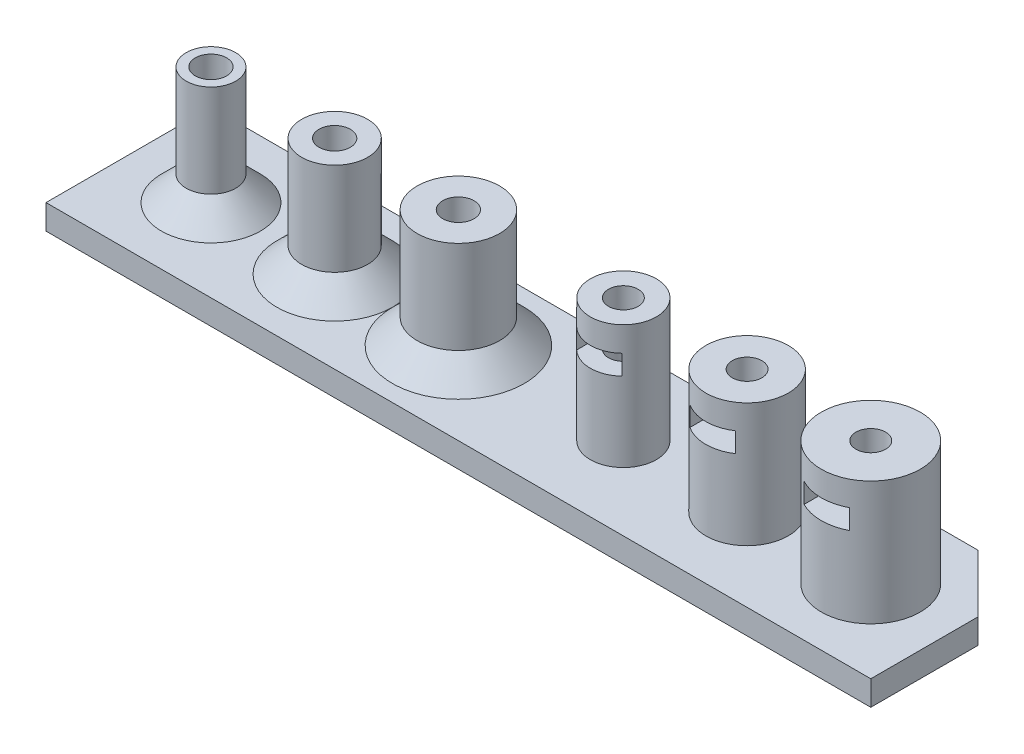
from build123d import *

# Parameters (mm, degrees)
SKETCH1_W           = 100
SKETCH1_H           = 20
BOSS_EXTRUDE1_DEPTH = 3
SKETCH2_R           = 4
SKETCH2_R_2         = 1.9
SKETCH2_R_3         = 3
SKETCH2_R_4         = 5
BOSS_EXTRUDE2_DEPTH = 14.25
CHAMFER1_SIZE       = 3
CHAMFER2_SIZE       = 3
CHAMFER3_SIZE       = 3
SKETCH14_R          = 4
SKETCH14_R_2        = 1.8
SKETCH14_R_3        = 5
SKETCH14_R_4        = 6
BOSS_EXTRUDE3_DEPTH = 15
CHAMFER4_SIZE       = 7
CUT_EXTRUDE2_START  = 12
CUT_EXTRUDE2_DEPTH  = 2.4
LPATTERN2_COUNT     = 3
LPATTERN2_PITCH     = 15


with BuildPart() as part:
    # Sketch1 → Boss-Extrude1 (new body)
    with BuildSketch(Plane(origin=(0, 0, 0), x_dir=(1, 0, 0), z_dir=(0, 1, 0))):
        Rectangle(SKETCH1_W, SKETCH1_H)
    extrude(amount=BOSS_EXTRUDE1_DEPTH)

    # Sketch2 → Boss-Extrude2 (add)
    # profile 1 of 3: a face of its own
    with BuildSketch(Plane(origin=(0, 3, 0), x_dir=(1, 0, 0), z_dir=(0, 1, 0))):
        with Locations(Location((-25, 0, 0), (0, 0, 90))):
            Circle(SKETCH2_R)
        with Locations(Location((-25, 0, 0), (0, 0, 90))):
            Circle(SKETCH2_R_2, mode=Mode.SUBTRACT)
    # profile 2 of 3: a face of its own
    with BuildSketch(Plane(origin=(0, 3, 0), x_dir=(1, 0, 0), z_dir=(0, 1, 0))):
        with Locations(Location((-40, 0, 0), (0, 0, 90))):
            Circle(SKETCH2_R_3)
        with Locations(Location((-40, 0, 0), (0, 0, 90))):
            Circle(SKETCH2_R_2, mode=Mode.SUBTRACT)
    # profile 3 of 3: a face of its own
    with BuildSketch(Plane(origin=(0, 3, 0), x_dir=(1, 0, 0), z_dir=(0, 1, 0))):
        with Locations(Location((-10, 0, 0), (0, 0, 90))):
            Circle(SKETCH2_R_4)
        with Locations(Location((-10, 0, 0), (0, 0, 90))):
            Circle(SKETCH2_R_2, mode=Mode.SUBTRACT)
    extrude(amount=BOSS_EXTRUDE2_DEPTH)

    # Chamfer1
    chamfer1_edges = [part.edges().sort_by_distance(p)[0] for p in [
        (-40, 3, 3),
    ]]
    chamfer(chamfer1_edges, length=CHAMFER1_SIZE)

    # Chamfer2
    chamfer2_edges = [part.edges().sort_by_distance(p)[0] for p in [
        (-25, 3, 4),
    ]]
    chamfer(chamfer2_edges, length=CHAMFER2_SIZE)

    # Chamfer3
    chamfer3_edges = [part.edges().sort_by_distance(p)[0] for p in [
        (-10, 3, 5),
    ]]
    chamfer(chamfer3_edges, length=CHAMFER3_SIZE - 0.0001)  # a hair under: the kernel refuses the full size

    # Sketch14 → Boss-Extrude3 (add)
    # profile 1 of 3: a face of its own
    with BuildSketch(Plane(origin=(0, 3, 0), x_dir=(1, 0, 0), z_dir=(0, 1, 0))):
        with Locations(Location((10, 0, 0), (0, 0, 90))):
            Circle(SKETCH14_R)
        with Locations(Location((10, 0, 0), (0, 0, 270))):
            Circle(SKETCH14_R_2, mode=Mode.SUBTRACT)
    # profile 2 of 3: a face of its own
    with BuildSketch(Plane(origin=(0, 3, 0), x_dir=(1, 0, 0), z_dir=(0, 1, 0))):
        with Locations(Location((25, 0, 0), (0, 0, 90))):
            Circle(SKETCH14_R_3)
        with Locations(Location((25, 0, 0), (0, 0, 270))):
            Circle(SKETCH14_R_2, mode=Mode.SUBTRACT)
    # profile 3 of 3: a face of its own
    with BuildSketch(Plane(origin=(0, 3, 0), x_dir=(1, 0, 0), z_dir=(0, 1, 0))):
        with Locations(Location((40, 0, 0), (0, 0, 90))):
            Circle(SKETCH14_R_4)
        with Locations(Location((40, 0, 0), (0, 0, 270))):
            Circle(SKETCH14_R_2, mode=Mode.SUBTRACT)
    extrude(amount=BOSS_EXTRUDE3_DEPTH)

    # Chamfer4
    chamfer4_edges = [part.edges().sort_by_distance(p)[0] for p in [
        (50, 1.5, -10),
    ]]
    chamfer(chamfer4_edges, length=CHAMFER4_SIZE)

    # Sketch16 → Cut-Extrude2 (cut)
    with BuildSketch(Plane(origin=(0, 3, 0), x_dir=(1, 0, 0), z_dir=(0, 1, 0)).offset(CUT_EXTRUDE2_START)):
        Polygon((7.25, -1.58771324), (7.25, -10), (12.75, -10), (12.75, -1.58771324), (12.75, 1.58771324), (10, 3.175426481), (7.25, 1.58771324), align=None)
    cut_extrude2 = extrude(amount=-CUT_EXTRUDE2_DEPTH, mode=Mode.SUBTRACT)

    # LPattern2: Cut-Extrude2 ×3
    with Locations(*[(i * LPATTERN2_PITCH, 0, 0) for i in range(1, LPATTERN2_COUNT)]):
        add(cut_extrude2, mode=Mode.SUBTRACT)


solid = part.part
